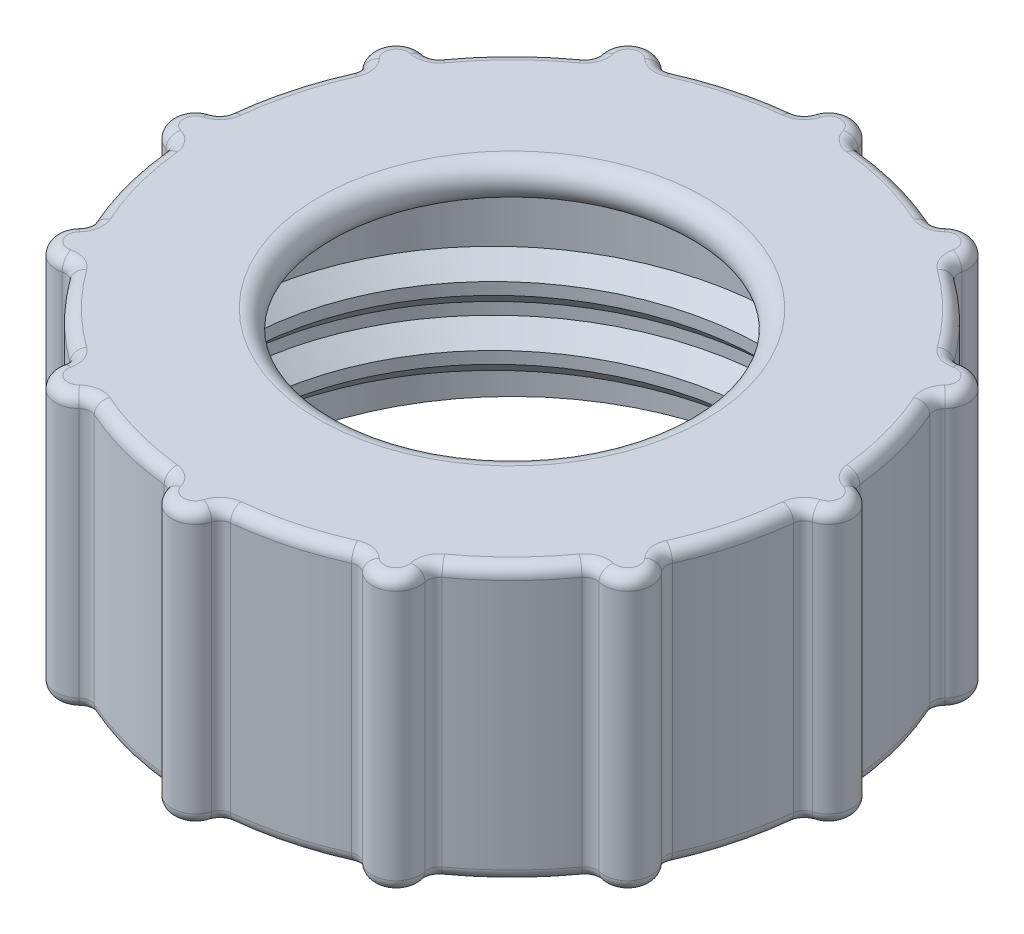
from build123d import *

# Parameters (mm, degrees)
SWEEP_2_PITCH            = 5
EXTRUDE_START            = -23
EXTRUDE_1_DEPTH          = 23
PATTERN_CIRCULAR_1_COUNT = 12
FILLET_1_R               = 1
FILLET_2_R               = 1


with BuildPart() as part:
    # 草图1 → 旋转1 (revolve)
    with BuildSketch(Plane.XY, mode=Mode.PRIVATE) as revolve_1_sk:
        with BuildLine():
            Line((-18.5, 5), (-16.15277675, 5))
            ThreePointArc((-16.15277675, 5), (-14.65277675, 6.5), (-16.15277675, 8))
            Line((-16.15277675, 8), (-23.5, 8))
            Line((-23.5, 8), (-26.5, 8))
            Line((-26.5, 8), (-26.5, -15))
            Line((-26.5, -15), (-23.5, -15))
            Line((-23.5, -15), (-23.5, 0))
            Line((-23.5, 0), (-18.5, 5))
        make_face()
    revolve(revolve_1_sk.sketch.rotate(Axis((0, -5338.803894625, 0), (0, 1, 0)), 180), axis=Axis((0, -5338.803894625, 0), (0, 1, 0)))

    # 扫描2: the profile of 草图3 profile screwed along a right-hand helix of 2 turns, 12 arcs to a turn; built about Z, then put on its axis
    sweep_2_z = Axis((0, 0, 0), (0, 0, 1))
    sweep_2_corners = [(23.5003, 0, -2.0003), (23.5003, 0, 2.0003), (22, 0, 0.5), (22, 0, -0.5)]
    with BuildLine(mode=Mode.PRIVATE) as sweep_2_profile:
        Line(sweep_2_corners[0], sweep_2_corners[1])
        Line(sweep_2_corners[1], sweep_2_corners[2])
        Line(sweep_2_corners[2], sweep_2_corners[3])
        Line(sweep_2_corners[3], sweep_2_corners[0])
    sweep_2_cap = Face(sweep_2_profile.wire())
    sweep_2_turn_angles = [0, 15, 30, 45, 60, 75, 90, 105, 120, 135, 150, 165, 180, 195, 210, 225, 240, 255, 270, 285, 300, 315, 330, 345, 360]
    sweep_2_turn_weights = [1, 0.9659258262890683, 1, 0.9659258262890683, 1, 0.9659258262890683, 1, 0.9659258262890683, 1, 0.9659258262890683, 1, 0.9659258262890683, 1, 0.9659258262890683, 1, 0.9659258262890683, 1, 0.9659258262890683, 1, 0.9659258262890683, 1, 0.9659258262890683, 1, 0.9659258262890683, 1]
    sweep_2_turn_rails = [Edge.make_bspline([Vector(p[0], p[1], 0).rotate(sweep_2_z, sweep_2_turn_angles[k]) / sweep_2_turn_weights[k] + Vector(0, 0, p[2] + SWEEP_2_PITCH * sweep_2_turn_angles[k] / 360) for k in range(25)], [0, 0, 0, 1, 1, 2, 2, 3, 3, 4, 4, 5, 5, 6, 6, 7, 7, 8, 8, 9, 9, 10, 10, 11, 11, 12, 12, 12], 2, sweep_2_turn_weights) for p in sweep_2_corners]
    sweep_2_turn_sides = [Face.make_surface_from_curves(sweep_2_turn_rails[p[0]], sweep_2_turn_rails[p[1]]) for p in [(0, 1), (1, 2), (2, 3), (3, 0)]]
    sweep_2 = Plane(origin=(0, -13, 0), x_dir=(1, 0, 0), z_dir=(0, 1, 0)) * Solid(Shell([*[p.moved(Location((0, 0, SWEEP_2_PITCH * i))) for i in range(2) for p in sweep_2_turn_sides], sweep_2_cap, sweep_2_cap.rotate(sweep_2_z, 720).moved(Location((0, 0, SWEEP_2_PITCH * 720 / 360)))]))
    add(sweep_2)

    # 草图7 → 凸台-拉伸1 (add)
    with BuildSketch(Plane(origin=(0, 8, 0), x_dir=(1, 0, 0), z_dir=(0, 1, 0)).offset(EXTRUDE_START)):
        with BuildLine():
            ThreePointArc((-1.918228683, 27.066037736), (-2.237465168, 26.580579975), (-2.77271237, 26.354545455))
            ThreePointArc((-2.77271237, 26.354545455), (0, 26.5), (2.77271237, 26.354545455))
            ThreePointArc((2.77271237, 26.354545455), (2.237465168, 26.580579975), (1.918228683, 27.066037736))
            ThreePointArc((1.918228683, 27.066037736), (0, 28.5), (-1.918228683, 27.066037736))
        make_face()
    extrude_1 = extrude(amount=EXTRUDE_1_DEPTH)

    # 阵列(圆周)1: 凸台-拉伸1 ×12 about axis
    pattern_circular_1_axis = Axis((0, 0, 0), (0, 1, 0))
    for i in range(1, PATTERN_CIRCULAR_1_COUNT):
        add(extrude_1.rotate(pattern_circular_1_axis, i * 360 / PATTERN_CIRCULAR_1_COUNT))

    # 圆角1
    fillet_1_edges = [part.edges().sort_by_distance(p)[0] for p in [
        (-6.858704695, 8, 25.597034397),
        (-2.237465168, 8, 26.580579975),
        (2.237465168, 8, 26.580579975),
        (0, 8, 28.5),
        (-18.738329701, 8, 18.738329701),
        (-15.227991664, 8, 21.900724922),
        (-11.352588312, 8, 24.13819009),
        (-14.25, 8, 24.681724008),
        (-25.597034397, 8, 6.858704695),
        (-24.13819009, 8, 11.352588312),
        (-21.900724922, 8, 15.227991664),
        (-24.681724008, 8, 14.25),
        (-25.597034397, 8, -6.858704695),
        (-26.580579975, 8, -2.237465168),
        (-26.580579975, 8, 2.237465168),
        (-28.5, 8, 0),
        (-18.738329701, 8, -18.738329701),
        (-21.900724922, 8, -15.227991664),
        (-24.13819009, 8, -11.352588312),
        (-24.681724008, 8, -14.25),
        (-6.858704695, 8, -25.597034397),
        (-11.352588312, 8, -24.13819009),
        (-15.227991664, 8, -21.900724922),
        (-14.25, 8, -24.681724008),
        (6.858704695, 8, -25.597034397),
        (2.237465168, 8, -26.580579975),
        (-2.237465168, 8, -26.580579975),
        (0, 8, -28.5),
        (18.738329701, 8, -18.738329701),
        (15.227991664, 8, -21.900724922),
        (11.352588312, 8, -24.13819009),
        (14.25, 8, -24.681724008),
        (25.597034397, 8, -6.858704695),
        (24.13819009, 8, -11.352588312),
        (21.900724922, 8, -15.227991664),
        (24.681724008, 8, -14.25),
        (25.597034397, 8, 6.858704695),
        (26.580579975, 8, 2.237465168),
        (26.580579975, 8, -2.237465168),
        (28.5, 8, 0),
        (18.738329701, 8, 18.738329701),
        (21.900724922, 8, 15.227991664),
        (24.13819009, 8, 11.352588312),
        (24.681724008, 8, 14.25),
        (6.858704695, 8, 25.597034397),
        (11.352588312, 8, 24.13819009),
        (15.227991664, 8, 21.900724922),
        (14.25, 8, 24.681724008),
    ]]
    fillet(fillet_1_edges, radius=FILLET_1_R)

    # 圆角2
    fillet_2_edges = [part.edges().sort_by_distance(p)[0] for p in [
        (-6.858704695, -15, 25.597034397),
        (-2.237465168, -15, 26.580579975),
        (2.237465168, -15, 26.580579975),
        (0, -15, 28.5),
        (-18.738329701, -15, 18.738329701),
        (-15.227991664, -15, 21.900724922),
        (-11.352588312, -15, 24.13819009),
        (-14.25, -15, 24.681724008),
        (-25.597034397, -15, 6.858704695),
        (-24.13819009, -15, 11.352588312),
        (-21.900724922, -15, 15.227991664),
        (-24.681724008, -15, 14.25),
        (-25.597034397, -15, -6.858704695),
        (-26.580579975, -15, -2.237465168),
        (-26.580579975, -15, 2.237465168),
        (-28.5, -15, 0),
        (-18.738329701, -15, -18.738329701),
        (-21.900724922, -15, -15.227991664),
        (-24.13819009, -15, -11.352588312),
        (-24.681724008, -15, -14.25),
        (-6.858704695, -15, -25.597034397),
        (-11.352588312, -15, -24.13819009),
        (-15.227991664, -15, -21.900724922),
        (-14.25, -15, -24.681724008),
        (6.858704695, -15, -25.597034397),
        (2.237465168, -15, -26.580579975),
        (-2.237465168, -15, -26.580579975),
        (0, -15, -28.5),
        (18.738329701, -15, -18.738329701),
        (15.227991664, -15, -21.900724922),
        (11.352588312, -15, -24.13819009),
        (14.25, -15, -24.681724008),
        (25.597034397, -15, -6.858704695),
        (24.13819009, -15, -11.352588312),
        (21.900724922, -15, -15.227991664),
        (24.681724008, -15, -14.25),
        (25.597034397, -15, 6.858704695),
        (26.580579975, -15, 2.237465168),
        (26.580579975, -15, -2.237465168),
        (28.5, -15, 0),
        (18.738329701, -15, 18.738329701),
        (21.900724922, -15, 15.227991664),
        (24.13819009, -15, 11.352588312),
        (24.681724008, -15, 14.25),
        (6.858704695, -15, 25.597034397),
        (11.352588312, -15, 24.13819009),
        (15.227991664, -15, 21.900724922),
        (14.25, -15, 24.681724008),
    ]]
    fillet(fillet_2_edges, radius=FILLET_2_R)


solid = part.part
